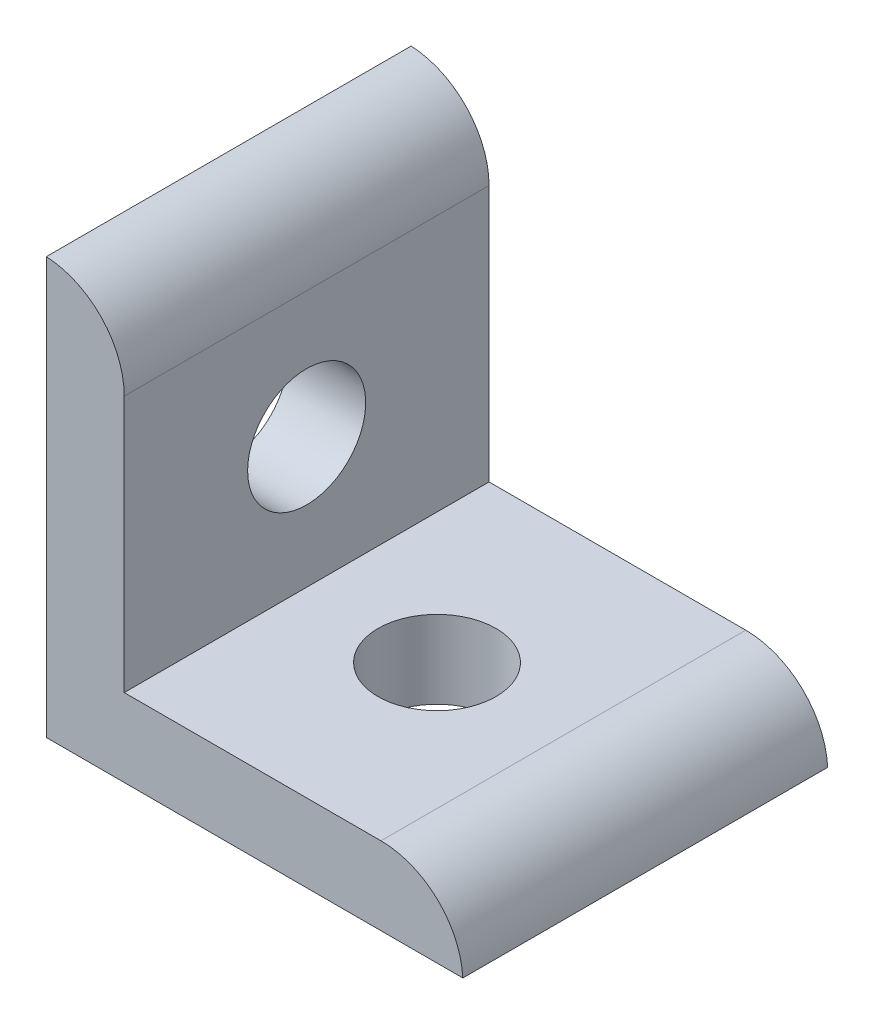
from build123d import *

# Parameters (mm, degrees)
BOSS_EXTRUDE1_DEPTH = 22.25
FILLET1_R           = 5
CUT_EXTRUDE1_REACH  = 44.254
SKETCH6_R           = 3.6
CUT_EXTRUDE2_REACH  = 44.254
SKETCH7_R           = 3.6


with BuildPart() as part:
    # Sketch2 → Boss-Extrude1 (new body)
    with BuildSketch(Plane.XY):
        Polygon((0, 25.4), (0, 0), (25.4, 0), (25.4, 4.75), (4.75, 4.75), (4.75, 25.4), align=None)
    extrude(amount=BOSS_EXTRUDE1_DEPTH)

    # Fillet1
    # the kernel refuses this fillet: 5 mm, written as the material it takes off along each edge
    with BuildSketch(Plane(origin=(4.75, 25.4, -12.484365222), x_dir=(0, -1, 0), z_dir=(0, 0, 1))) as fillet1_piece_1:
        with BuildLine():
            CenterArc((4.993746089, -5), FILLET1_R, 90, 87.134016017)
            Line((0, -4.75), (-0.099874922, -4.745))
            ThreePointArc((-0.099874922, -4.745), (-0.1, -2.375), (-0.1, 0))
            Line((-0.1, 0), (0, 0.1))
            Line((0, 0.1), (4.993746089, 0.1))
            Line((4.993746089, 0.1), (4.993746089, 0))
        make_face()
    extrude(amount=47.218730444, mode=Mode.SUBTRACT)
    with BuildSketch(Plane(origin=(25.4, 4.75, -12.484365222), x_dir=(0, -1, 0), z_dir=(0, 0, 1))) as fillet1_piece_2:
        with BuildLine():
            CenterArc((5, -4.993746089), FILLET1_R, 92.865983983, 87.134016017)
            Line((0, -4.993746089), (-0.1, -4.993746089))
            Line((-0.1, -4.993746089), (-0.1, 0))
            Line((-0.1, 0), (0, 0.1))
            ThreePointArc((0, 0.1), (2.375, 0.1), (4.745, 0.099874922))
            Line((4.745, 0.099874922), (4.75, 0))
        make_face()
    extrude(amount=47.218730444, mode=Mode.SUBTRACT)

    # Sketch6 → Cut-Extrude1 (cut, up to next)
    with BuildSketch(Plane.XZ, mode=Mode.PRIVATE) as cut_extrude1_sk1:
        with Locations(Location((12.7, 11.125, 0), (0, 0, 270))):
            Circle(SKETCH6_R)
    cut_extrude1_tool1 = extrude(cut_extrude1_sk1.sketch, amount=-CUT_EXTRUDE1_REACH, mode=Mode.PRIVATE) & part.part
    add(cut_extrude1_tool1.solids().sort_by_distance((12.7, 0, 11.125))[0], mode=Mode.SUBTRACT)

    # Sketch7 → Cut-Extrude2 (cut, up to next)
    with BuildSketch(Plane.ZY, mode=Mode.PRIVATE) as cut_extrude2_sk1:
        with Locations((11.125, 12.7)):
            Circle(SKETCH7_R)
    cut_extrude2_tool1 = extrude(cut_extrude2_sk1.sketch, amount=-CUT_EXTRUDE2_REACH, mode=Mode.PRIVATE) & part.part
    add(cut_extrude2_tool1.solids().sort_by_distance((0, 12.7, 11.125))[0], mode=Mode.SUBTRACT)


solid = part.part
